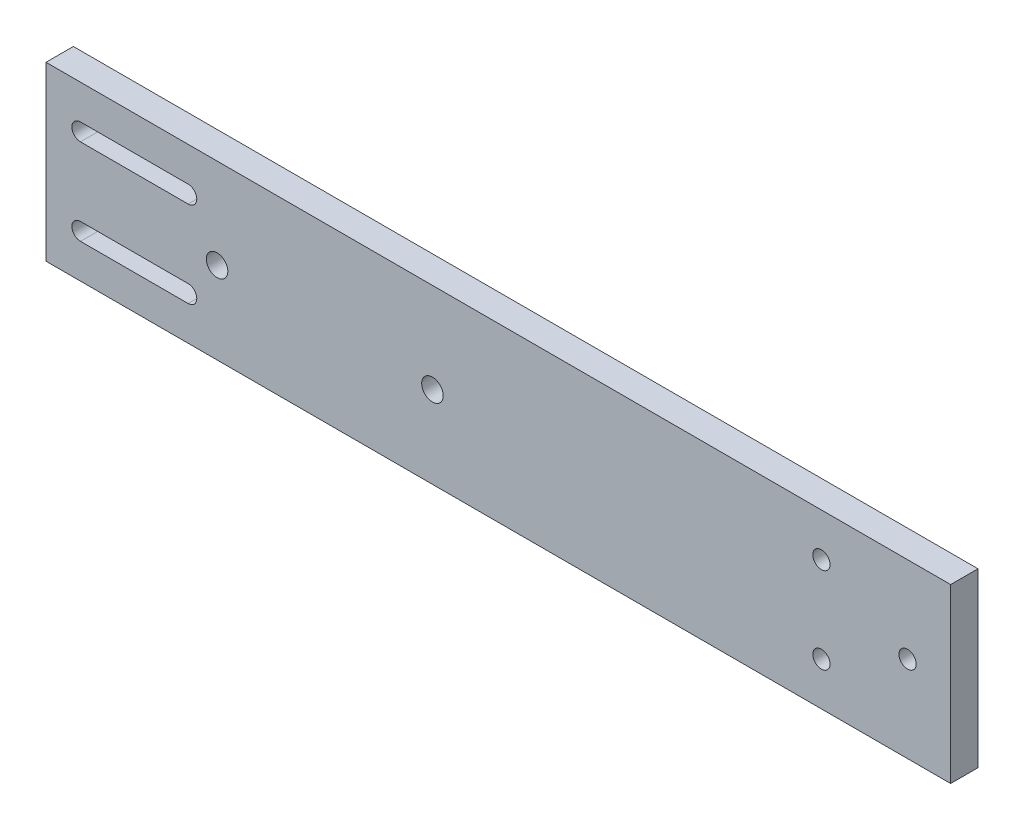
from build123d import *

# Parameters (mm, degrees)
SKETCH1_W           = 210
SKETCH1_H           = 40
SKETCH1_R           = 2
BOSS_EXTRUDE1_DEPTH = 6.35
SKETCH2_R           = 2.5
CUT_EXTRUDE1_DEPTH  = 10


with BuildPart() as part:
    # Sketch1 → Boss-Extrude1 (new body)
    with BuildSketch(Plane.XY):
        with Locations((105, 20)):
            Rectangle(SKETCH1_W, SKETCH1_H)
        with Locations((180, 30)):
            Circle(SKETCH1_R, mode=Mode.SUBTRACT)
        with Locations((180, 10)):
            Circle(SKETCH1_R, mode=Mode.SUBTRACT)
        with Locations((200, 20)):
            Circle(SKETCH1_R, mode=Mode.SUBTRACT)
        with BuildLine():
            Line((8, 32), (33, 32))
            ThreePointArc((33, 32), (35, 30), (33, 28))
            Line((33, 28), (8, 28))
            ThreePointArc((8, 28), (6, 30), (8, 32))
        make_face(mode=Mode.SUBTRACT)
        with BuildLine():
            Line((8, 12), (33, 12))
            ThreePointArc((33, 12), (35, 10), (33, 8))
            Line((33, 8), (8, 8))
            ThreePointArc((8, 8), (6, 10), (8, 12))
        make_face(mode=Mode.SUBTRACT)
    extrude(amount=BOSS_EXTRUDE1_DEPTH)

    # Sketch2 → Cut-Extrude1 (cut)
    with BuildSketch(Plane(origin=(0, 0, 0), x_dir=(-1, 0, 0), z_dir=(0, 0, -1))):
        with Locations((-89.71, 19.06)):
            Circle(SKETCH2_R)
        with Locations((-39.71, 19.06)):
            Circle(SKETCH2_R)
    extrude(amount=-CUT_EXTRUDE1_DEPTH, mode=Mode.SUBTRACT)


solid = part.part
